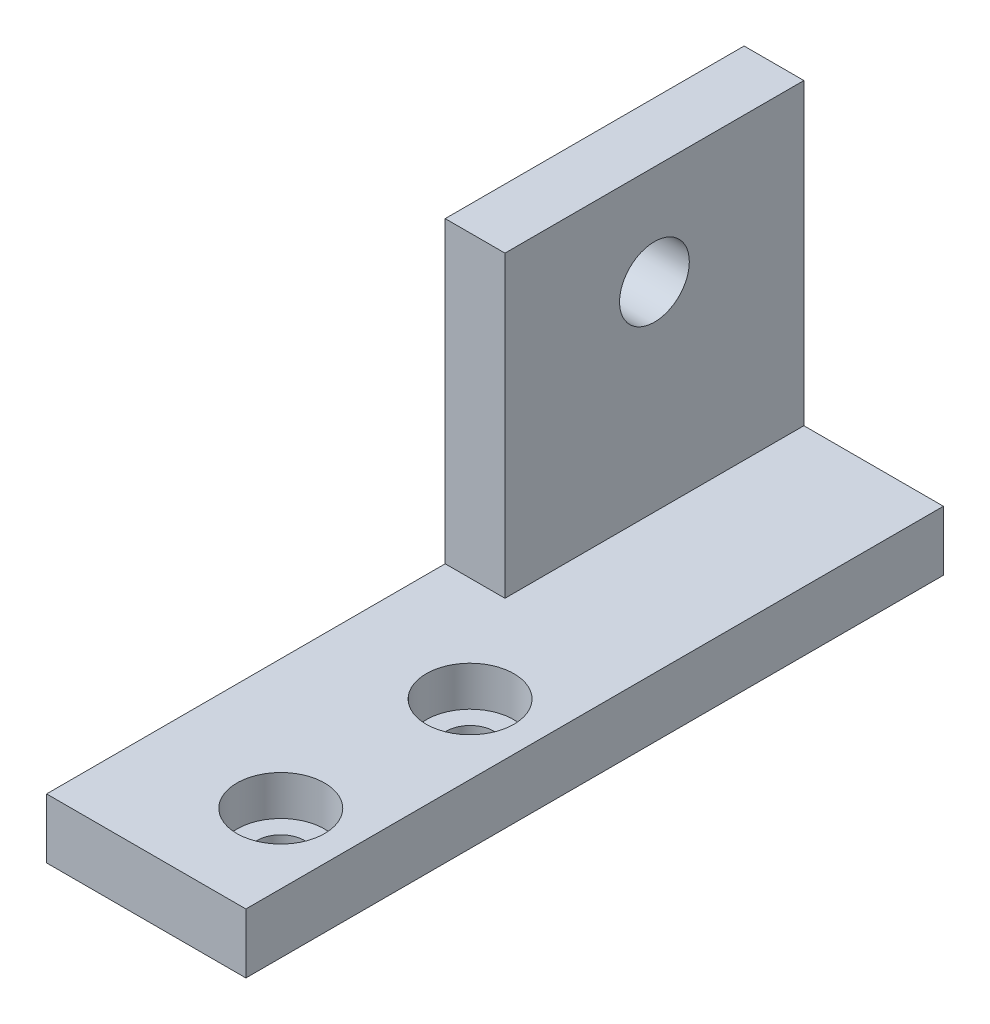
from build123d import *

# Parameters (mm, degrees)
SKETCH1_W                      = 10
SKETCH1_H                      = 20
SKETCH1_R                      = 1.175
BOSS_EXTRUDE1_DEPTH            = 3
CBORE_FOR_M2_SHCS1_D           = 2.4
CBORE_FOR_M2_SHCS1_CBORE_D     = 4.4
CBORE_FOR_M2_SHCS1_CBORE_DEPTH = 2
SKETCH6_W                      = 10
SKETCH6_H                      = 3
BOSS_EXTRUDE2_DEPTH            = 15
SKETCH8_W                      = 3
SKETCH8_H                      = 15
BOSS_EXTRUDE3_DEPTH            = 15
SKETCH9_R                      = 1.75
CUT_EXTRUDE1_DEPTH             = 40.974992183


with BuildPart() as part:
    # Sketch1 → Boss-Extrude1 (new body)
    with BuildSketch(Plane(origin=(0, 0, 0), x_dir=(1, 0, 0), z_dir=(0, 1, 0))):
        with Locations((5, 10)):
            Rectangle(SKETCH1_W, SKETCH1_H)
        with Locations((6.5, 5.25)):
            Circle(SKETCH1_R, mode=Mode.SUBTRACT)
        with Locations((6.5, 14.75)):
            Circle(SKETCH1_R, mode=Mode.SUBTRACT)
    extrude(amount=BOSS_EXTRUDE1_DEPTH)

    # CBORE for M2 SHCS1 (through all)
    with Locations(Plane(origin=(0, 3, 0), x_dir=(1, 0, 0), z_dir=(0, 1, 0))):
        with Locations((6.5, 14.75), (6.5, 5.25)):
            CounterBoreHole(CBORE_FOR_M2_SHCS1_D / 2, CBORE_FOR_M2_SHCS1_CBORE_D / 2, CBORE_FOR_M2_SHCS1_CBORE_DEPTH)

    # Sketch6 → Boss-Extrude2 (add)
    with BuildSketch(Plane(origin=(0, 0, -20), x_dir=(-1, 0, 0), z_dir=(0, 0, -1))):
        with Locations((-5, 1.5)):
            Rectangle(SKETCH6_W, SKETCH6_H)
    extrude(amount=BOSS_EXTRUDE2_DEPTH)

    # Sketch8 → Boss-Extrude3 (add)
    with BuildSketch(Plane(origin=(0, 3, 0), x_dir=(1, 0, 0), z_dir=(0, 1, 0))):
        with Locations((1.5, 27.5)):
            Rectangle(SKETCH8_W, SKETCH8_H)
    extrude(amount=BOSS_EXTRUDE3_DEPTH)

    # Sketch9 → Cut-Extrude1 (cut, through all)
    with BuildSketch(Plane(origin=(3, 0, 0), x_dir=(0, 0, -1), z_dir=(1, 0, 0))):
        with Locations((27.5, 13)):
            Circle(SKETCH9_R)
    extrude(amount=-CUT_EXTRUDE1_DEPTH, mode=Mode.SUBTRACT)


solid = part.part
